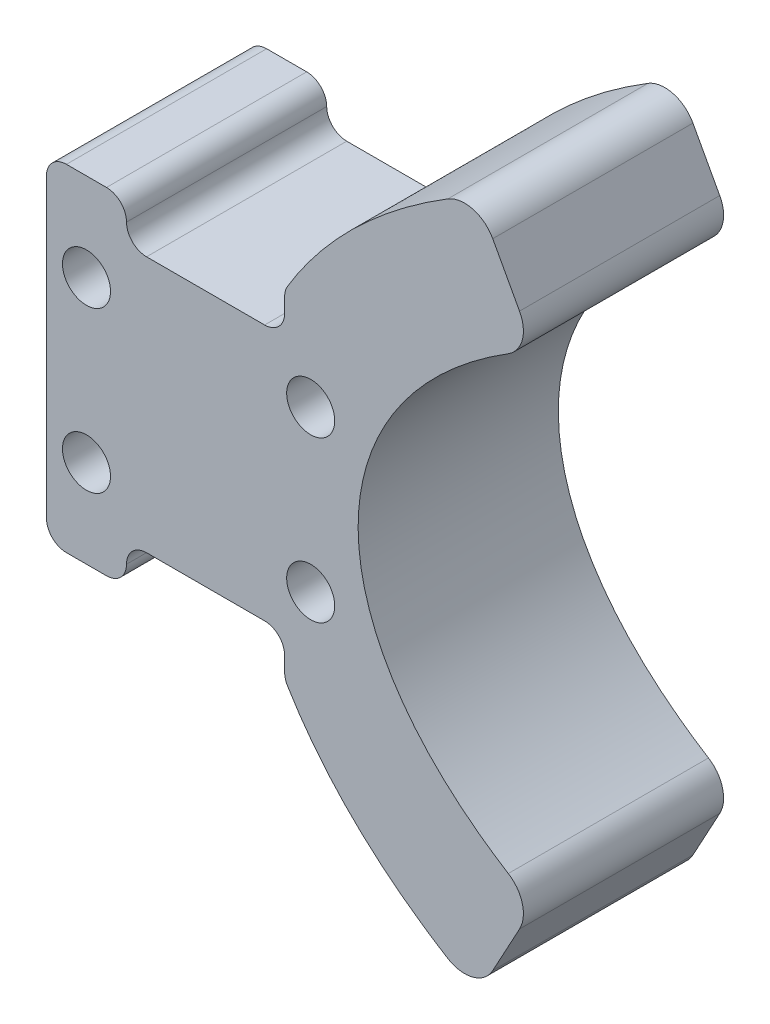
from build123d import *

# Parameters (mm, degrees)
SKETCH2_R           = 3
BOSS_EXTRUDE1_DEPTH = 25
BOSS_EXTRUDE2_DEPTH = 25
SKETCH4_W           = 19.746158687
SKETCH4_H           = 5.000000001
SKETCH4_W_2         = 19.746896681
SKETCH4_H_2         = 5
CUT_EXTRUDE1_DEPTH  = 115.725186296
FILLET1_R           = 2.5
SKETCH5_R           = 3
CUT_EXTRUDE2_DEPTH  = 115.725186296


with BuildPart() as part:
    # Sketch2 → Boss-Extrude1 (new body)
    with BuildSketch(Plane.XY):
        with BuildLine():
            Line((-44.84499572, 33.411675358), (-48.18980095, 39.574873881))
            ThreePointArc((-48.18980095, 39.574873881), (-50.672758106, 41.531314894), (-53.800671062, 41.074261054))
            add(Edge.make_bspline(
                [(-53.800671062, 41.074261054), (-54.48767514, 40.651810622), (-58.202157398, 38.284629617), (-65.057392245, 32.977438932), (-72.95010089, 23.979669569), (-78.627729923, 12.632057233), (-80.687458565, 0.00103574), (-78.627967037, -12.630024416), (-72.950551026, -23.977743332), (-64.551684805, -33.55290014), (-57.571999896, -38.752778812), (-53.808586452, -41.068411447), (-53.800589503, -41.073329934)],
                knots=[5.497383927, 5.497383927, 5.497383927, 5.497383927, 5.533297999, 5.694136685, 5.890486225, 6.086835766, 6.283185307, 6.479534848, 6.675884389, 6.87223393, 7.068583471, 7.069001522, 7.069001522, 7.069001522, 7.069001522], degree=3))
            ThreePointArc((-53.800589503, -41.073329934), (-50.672539001, -41.530627312), (-48.189401667, -39.574138156))
            Line((-48.189401667, -39.574138156), (-44.84499572, -33.411675358))
            ThreePointArc((-44.84499572, -33.411675358), (-44.493215778, -30.482399972), (-46.245407837, -28.108747428))
            add(Edge.make_bspline(
                [(-46.245407837, 28.108747428), (-91.360422528, 0), (-46.245407837, -28.108747428)],
                knots=[5.50397375, 5.50397375, 5.50397375, 7.062396864, 7.062396864, 7.062396864], degree=2, weights=[1, 0.711467813, 1]))
            ThreePointArc((-46.245407837, 28.108747428), (-44.493215778, 30.482399972), (-44.84499572, 33.411675358))
        make_face()
        with Locations((-70.923488038, 10)):
            Circle(SKETCH2_R, mode=Mode.SUBTRACT)
        with Locations((-70.923488038, -10)):
            Circle(SKETCH2_R, mode=Mode.SUBTRACT)
    extrude(amount=BOSS_EXTRUDE1_DEPTH)

    # Sketch3 → Boss-Extrude2 (add)
    with BuildSketch(Plane.XY.offset(25)):
        with BuildLine():
            Line((-74.177329351, 21), (-103.926591357, 21))
            Line((-103.926591357, 21), (-103.926591357, -21))
            Line((-103.926591357, -21), (-74.176591357, -21))
            add(Edge.make_bspline(
                [(-74.177329351, 21), (-75.755958039, 18.282076683), (-78.800306246, 11.573755088), (-80.687458565, 0.00103574), (-78.800400628, -11.572472575), (-75.755678045, -18.281470977), (-74.176591357, -21)],
                knots=[5.939840224, 5.939840224, 5.939840224, 5.939840224, 6.086835766, 6.283185307, 6.479534848, 6.626565531, 6.626565531, 6.626565531, 6.626565531], degree=3))
        make_face()
    extrude(amount=-BOSS_EXTRUDE2_DEPTH)

    # Sketch4 → Cut-Extrude1 (cut, through all)
    with BuildSketch(Plane.XY.offset(25)):
        with Locations((-84.050408695, 18.500000001)):
            Rectangle(SKETCH4_W, SKETCH4_H)
        with Locations((-84.050039698, -18.5)):
            Rectangle(SKETCH4_W_2, SKETCH4_H_2)
    extrude(amount=-CUT_EXTRUDE1_DEPTH, mode=Mode.SUBTRACT)

    # Fillet1
    fillet1_edges = [part.edges().sort_by_distance(p)[0] for p in [
        (-93.923488038, 16, 12.5),
        (-93.923488038, 21.000000001, 12.5),
        (-103.926591357, -21, 12.5),
        (-93.923488038, -21, 12.5),
        (-93.923488038, -16, 12.5),
        (-74.176591357, -16, 12.5),
        (-74.176591357, -21, 12.5),
        (-74.177329351, 21, 12.5),
        (-74.177329351, 16, 12.5),
        (-103.926591357, 21, 12.5),
    ]]
    fillet(fillet1_edges, radius=FILLET1_R - 0.0001)  # a hair under: the kernel refuses the full size

    # Sketch5 → Cut-Extrude2 (cut, through all)
    with BuildSketch(Plane.XY.offset(25)):
        with Locations((-98.923488038, 10)):
            Circle(SKETCH5_R)
        with Locations((-98.923488038, -10)):
            Circle(SKETCH5_R)
    extrude(amount=-CUT_EXTRUDE2_DEPTH, mode=Mode.SUBTRACT)


solid = part.part
